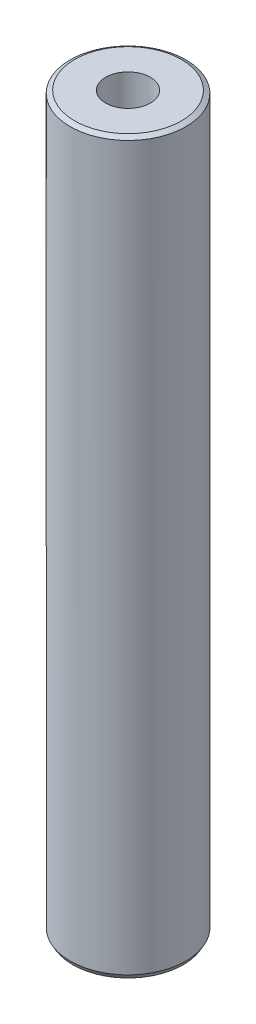
from build123d import *
from OCP.BRepFilletAPI import BRepFilletAPI_MakeChamfer

# Parameters (mm, degrees)
SKETCH1_R           = 35
BOSS_EXTRUDE1_DEPTH = 441.239828059
SKETCH2_R           = 13.540803779
CUT_EXTRUDE1_DEPTH  = 445.007416453
CHAMFER1_SIZE       = 1.597615496
CHAMFER1_SIZE2      = 2.76715121


with BuildPart() as part:
    # Sketch1 → Boss-Extrude1 (new body)
    with BuildSketch(Plane(origin=(0, 0, 0), x_dir=(1, 0, 0), z_dir=(0, 1, 0))):
        Circle(SKETCH1_R)
    extrude(amount=BOSS_EXTRUDE1_DEPTH)

    # Sketch2 → Cut-Extrude1 (cut, through all)
    with BuildSketch(Plane(origin=(0, 0, 0), x_dir=(1, 0, 0), z_dir=(0, 1, 0))):
        Circle(SKETCH2_R)
    extrude(amount=CUT_EXTRUDE1_DEPTH, mode=Mode.SUBTRACT)

    # Chamfer1: one chamfer whose edges measure the first distance from different faces: ONE call of the kernel's chamfer builder (chamfer() names one face for all edges)
    chamfer1_edges_1 = [part.edges().sort_by_distance(p)[0] for p in [
        (-35, 441.239828059, 0),
    ]]
    chamfer1_side_1 = [part.faces().sort_by_distance(p)[0] for p in [
        (-35, 220.619914029, 0),
    ]]
    chamfer1_edges_2 = [part.edges().sort_by_distance(p)[0] for p in [
        (-35, 0, 0),
    ]]
    chamfer1_side_2 = [part.faces().sort_by_distance(p)[0] for p in [
        (-34.010050506, 0, 0),
    ]]
    chamfer1 = BRepFilletAPI_MakeChamfer(part.part.solid().wrapped)
    for e in chamfer1_edges_1:
        chamfer1.Add(CHAMFER1_SIZE, CHAMFER1_SIZE2, e.wrapped, chamfer1_side_1[0].wrapped)  # the first distance lies on this face
    for e in chamfer1_edges_2:
        chamfer1.Add(CHAMFER1_SIZE, CHAMFER1_SIZE2, e.wrapped, chamfer1_side_2[0].wrapped)  # the first distance lies on this face
    add(Compound.cast(chamfer1.Shape()), mode=Mode.REPLACE)


solid = part.part
